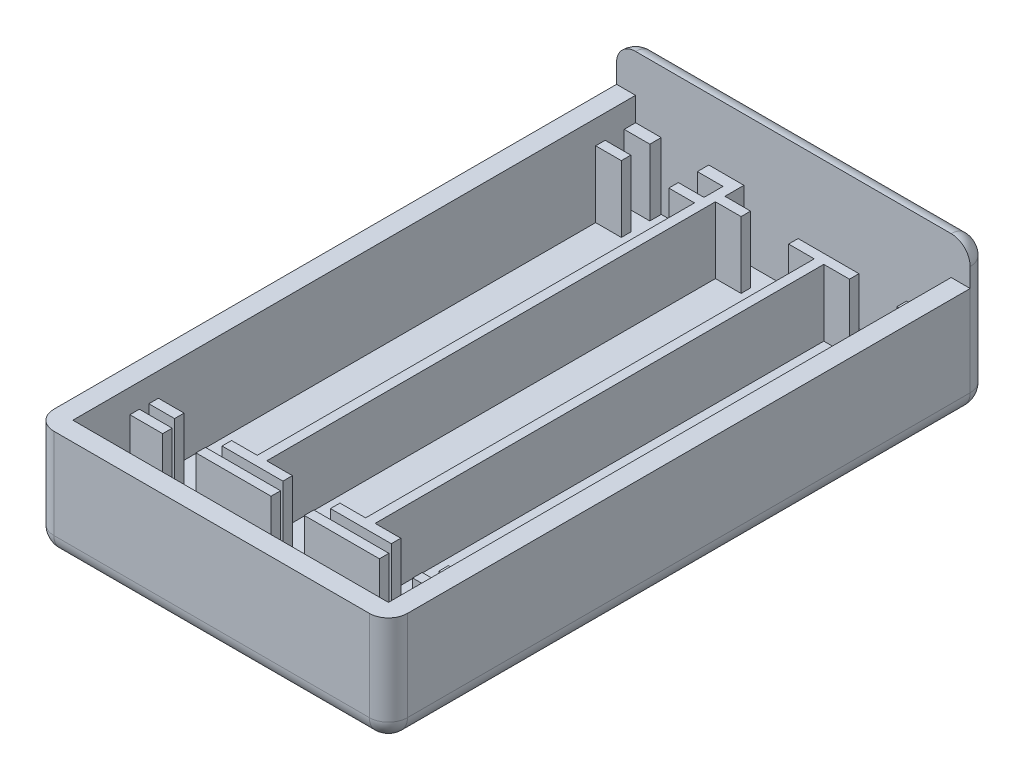
from build123d import *

# Parameters (mm, degrees)
SKETCH1_W           = 37.2
SKETCH1_H           = 63.2
BOSS_EXTRUDE1_DEPTH = 15.5
FILLET1_R           = 2
SHELL1_START        = -16.6
SHELL1_OUTLINE_W    = 13.5
SHELL1_OUTLINE_H    = 59.2
SHELL1_DEPTH        = 33.2
CUT_EXTRUDE1_START  = 9.5
SKETCH2_W           = 37.2
SKETCH2_H           = 61.2
CUT_EXTRUDE1_DEPTH  = 4
SKETCH3_W           = 2.7
SKETCH3_H           = 1
SKETCH3_W_2         = 1
SKETCH3_H_2         = 47.2
SKETCH3_W_3         = 33.2
SKETCH3_H_3         = 1.2
BOSS_EXTRUDE2_DEPTH = 7
SKETCH4_W           = 3.5
SKETCH4_H           = 1
CUT_EXTRUDE2_DEPTH  = 7


# Read off the part's stored shape, not the designer's step: Shell1
with BuildPart() as part:
    # Sketch1 → Boss-Extrude1 (new body)
    with BuildSketch(Plane(origin=(0, 0, 0), x_dir=(1, 0, 0), z_dir=(0, 1, 0))):
        Rectangle(SKETCH1_W, SKETCH1_H)
    extrude(amount=BOSS_EXTRUDE1_DEPTH)

    # Fillet1
    fillet1_edges = [part.edges().sort_by_distance(p)[0] for p in [
        (-18.6, 15.5, 0),
        (0, 15.5, 31.6),
        (18.6, 15.5, 0),
        (0, 0, 31.6),
        (-18.6, 0, 0),
        (0, 0, -31.6),
        (18.6, 0, 0),
        (18.6, 7.75, 31.6),
        (-18.6, 7.75, 31.6),
        (-18.6, 7.75, -31.6),
        (18.6, 7.75, -31.6),
        (0, 15.5, -31.6),
    ]]
    fillet(fillet1_edges, radius=FILLET1_R)

    # Shell1 outline → Shell1 (cut)
    with BuildSketch(Plane.YZ.offset(SHELL1_START)):
        with Locations((8.75, 0)):
            Rectangle(SHELL1_OUTLINE_W, SHELL1_OUTLINE_H)
    extrude(amount=SHELL1_DEPTH, mode=Mode.SUBTRACT)

    # Sketch2 → Cut-Extrude1 (cut)
    with BuildSketch(Plane(origin=(0, 2, 0), x_dir=(1, 0, 0), z_dir=(0, 1, 0)).offset(CUT_EXTRUDE1_START)):
        with Locations((0, -1)):
            Rectangle(SKETCH2_W, SKETCH2_H)
    extrude(amount=CUT_EXTRUDE1_DEPTH, mode=Mode.SUBTRACT)

    # Sketch3 → Boss-Extrude2 (add)
    with BuildSketch(Plane(origin=(0, 2, 0), x_dir=(1, 0, 0), z_dir=(0, 1, 0))):
        with Locations((-15.25, 25.9)):
            Rectangle(SKETCH3_W, SKETCH3_H)
        with Locations((-7.55, 25.9)):
            Rectangle(SKETCH3_W, SKETCH3_H)
        Polygon((-6.2, 29.6), (-6.2, 28.4), (-6.2, 26.4), (-6.2, 25.4), (-6.2, -20.6), (-5.2, -20.6), (-5.2, 26.6), (-5.2, 27.6), (-5.2, 29.6), align=None)
        with Locations((-3.85, 27.1)):
            Rectangle(SKETCH3_W, SKETCH3_H)
        Polygon((8.9, 27.6), (2.5, 27.6), (2.5, 26.6), (5.2, 26.6), (6.2, 26.6), (8.9, 26.6), align=None)
        with Locations((15.25, 27.1)):
            Rectangle(SKETCH3_W, SKETCH3_H)
        with Locations((5.7, 3)):
            Rectangle(SKETCH3_W_2, SKETCH3_H_2)
        with Locations((-15.25, -21.1)):
            Rectangle(SKETCH3_W, SKETCH3_H)
        Polygon((-5.2, -20.6), (-6.2, -20.6), (-8.9, -20.6), (-8.9, -21.6), (-2.5, -21.6), (-2.5, -20.6), align=None)
        Polygon((5.2, -20.6), (2.5, -20.6), (2.5, -21.6), (8.9, -21.6), (8.9, -20.6), (6.2, -20.6), align=None)
        with Locations((15.25, -21.1)):
            Rectangle(SKETCH3_W, SKETCH3_H)
        with Locations((0, -23.1)):
            Rectangle(SKETCH3_W_3, SKETCH3_H)
        with Locations((-15.25, 29)):
            Rectangle(SKETCH3_W, SKETCH3_H_3)
        with Locations((-7.55, 29)):
            Rectangle(SKETCH3_W, SKETCH3_H_3)
    extrude(amount=BOSS_EXTRUDE2_DEPTH)

    # Sketch4 → Cut-Extrude2 (cut)
    with BuildSketch(Plane(origin=(0, 9, 0), x_dir=(1, 0, 0), z_dir=(0, 1, 0))):
        with Locations((-11.4, -23.1)):
            Rectangle(SKETCH4_W, SKETCH4_H)
        with Locations((0, -23.1)):
            Rectangle(SKETCH4_W, SKETCH4_H)
        with Locations((11.4, -23.1)):
            Rectangle(SKETCH4_W, SKETCH4_H)
    extrude(amount=-CUT_EXTRUDE2_DEPTH, mode=Mode.SUBTRACT)


solid = part.part
